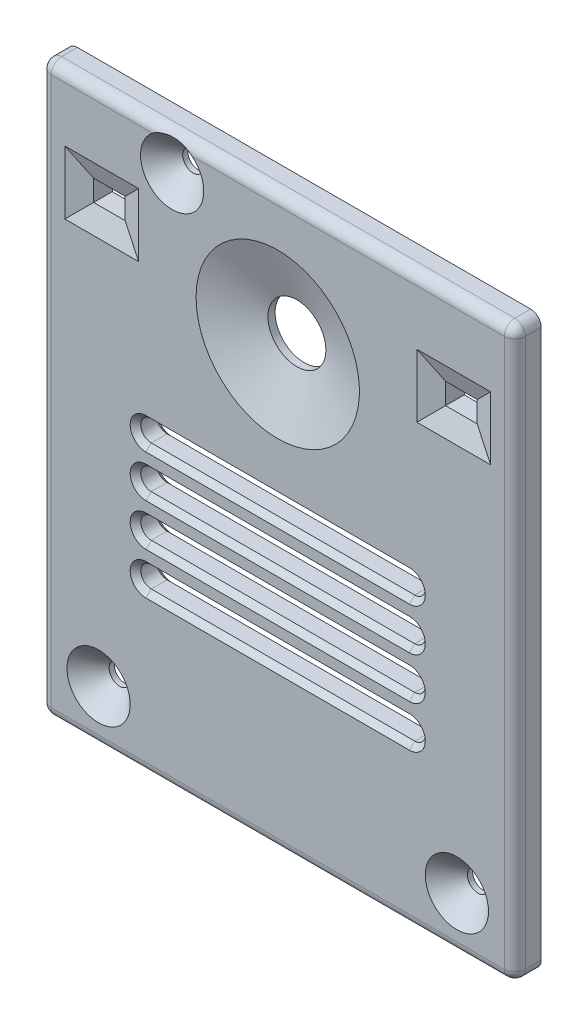
from build123d import *

# Parameters (mm, degrees)
SKETCH1_R           = 1
SKETCH1_R_2         = 1.0000000000000018
BOSS_EXTRUDE1_DEPTH = 2.5
SKETCH2_R           = 2.7499999999999996
CUT_EXTRUDE1_DEPTH  = 2.5
CHAMFER1_SIZE       = 5
CHAMFER1_SIZE2      = 1.819851171331016
CUT_EXTRUDE2_DEPTH  = 2.5
CHAMFER2_SIZE       = 0.5
CHAMFER3_SIZE       = 2
SKETCH4_W           = 2.9999999999999982
SKETCH4_H           = 2
CUT_EXTRUDE3_DEPTH  = 2.5
CHAMFER4_SIZE       = 2
CHAMFER4_SIZE2      = 0.7279404685324065
FILLET1_R           = 1


with BuildPart() as part:
    # Sketch1 → Boss-Extrude1 (new body)
    with BuildSketch(Plane.XY):
        with BuildLine():
            Line((21.499999999999993, -26.999999999999996), (-21.499999999999993, -26.999999999999996))
            ThreePointArc((-21.499999999999993, -26.999999999999996), (-22.207106781186546, -26.707106781186543), (-22.5, -25.99999999999999))
            Line((-22.5, -25.99999999999999), (-22.5, 25.99999999999999))
            ThreePointArc((-22.5, 25.99999999999999), (-22.207106781186546, 26.707106781186543), (-21.499999999999993, 26.999999999999996))
            Line((-21.499999999999993, 26.999999999999996), (21.499999999999993, 26.999999999999996))
            ThreePointArc((21.499999999999993, 26.999999999999996), (22.207106781186546, 26.707106781186543), (22.5, 25.99999999999999))
            Line((22.5, 25.99999999999999), (22.5, -25.99999999999999))
            ThreePointArc((22.5, -25.99999999999999), (22.207106781186546, -26.707106781186543), (21.499999999999993, -26.999999999999996))
        make_face()
        with Locations((-10.018444645439217, 23.665000000000006)):
            Circle(SKETCH1_R, mode=Mode.SUBTRACT)
        with Locations((-17, -22.000000000000007)):
            Circle(SKETCH1_R_2, mode=Mode.SUBTRACT)
        with Locations((17, -22.000000000000004)):
            Circle(SKETCH1_R_2, mode=Mode.SUBTRACT)
    extrude(amount=BOSS_EXTRUDE1_DEPTH)

    # Sketch2 → Cut-Extrude1 (cut)
    with BuildSketch(Plane.XY.offset(2.5)):
        with Locations((0, 14.599999999999996)):
            Circle(SKETCH2_R)
    extrude(amount=-CUT_EXTRUDE1_DEPTH, mode=Mode.SUBTRACT)

    # Chamfer1
    chamfer1_edges = [part.edges().sort_by_distance(p)[0] for p in [
        (-2.7499999999999996, 14.599999999999996, 2.5),
    ]]
    chamfer1_side = [part.faces().sort_by_distance(p)[0] for p in [
        (0.01313623413448006, -0.11811006320101064, 2.5),
    ]]
    chamfer(chamfer1_edges, length=CHAMFER1_SIZE, length2=CHAMFER1_SIZE2, reference=chamfer1_side[0])

    # Sketch3 → Cut-Extrude2 (cut)
    with BuildSketch(Plane.XY.offset(2.5)):
        with BuildLine():
            Line((-12.5, 2), (12.5, 2.0000000000000053))
            ThreePointArc((12.5, 2.0000000000000053), (13.5, 1.0000000000000036), (12.5, 4.34e-15))
            Line((12.5, 4.34e-15), (-12.5, 0))
            ThreePointArc((-12.5, 0), (-13.5, 1.0000000000000002), (-12.5, 2))
        make_face()
        with BuildLine():
            Line((-12.5, -2), (12.5, -2))
            ThreePointArc((12.5, -2), (13.5, -3), (12.5, -4))
            Line((12.5, -4), (-12.5, -4))
            ThreePointArc((-12.5, -4), (-13.5, -3), (-12.5, -2))
        make_face()
        with BuildLine():
            Line((-12.5, -6.000000000000001), (12.5, -6.000000000000001))
            ThreePointArc((12.5, -6.000000000000001), (13.5, -7), (12.5, -8))
            Line((12.5, -8), (-12.5, -8))
            ThreePointArc((-12.5, -8), (-13.5, -7), (-12.5, -6.000000000000001))
        make_face()
        with BuildLine():
            Line((-12.5, -9.999999999999998), (12.5, -9.999999999999998))
            ThreePointArc((12.5, -9.999999999999998), (13.5, -11), (12.5, -12))
            Line((12.5, -12), (-12.5, -12))
            ThreePointArc((-12.5, -12), (-13.500000000000002, -11), (-12.5, -9.999999999999998))
        make_face()
    extrude(amount=-CUT_EXTRUDE2_DEPTH, mode=Mode.SUBTRACT)

    # Chamfer2
    chamfer2_edges = [part.edges().sort_by_distance(p)[0] for p in [
        (-13.5, 0.9999999999999999, 0),
        (0, 2.0000000000000027, 0),
        (13.5, 1.0000000000000049, 0),
        (0, 2.17e-15, 0),
        (-13.5, 0.9999999999999999, 2.5),
        (0, 2.17e-15, 2.5),
        (13.5, 1.0000000000000049, 2.5),
        (0, 2.0000000000000027, 2.5),
        (-13.5, -3, 0),
        (0, -2, 0),
        (13.5, -3, 0),
        (0, -4, 0),
        (-13.5, -3, 2.5),
        (0, -4, 2.5),
        (13.5, -3, 2.5),
        (0, -2, 2.5),
        (-13.5, -7, 0),
        (0, -6.000000000000001, 0),
        (13.5, -7, 0),
        (0, -8, 0),
        (-13.5, -7, 2.5),
        (0, -8, 2.5),
        (13.5, -7, 2.5),
        (0, -6.000000000000001, 2.5),
        (-13.500000000000002, -11, 0),
        (0, -9.999999999999998, 0),
        (13.5, -11, 0),
        (0, -12, 0),
        (-13.500000000000002, -11, 2.5),
        (0, -12, 2.5),
        (13.5, -11, 2.5),
        (0, -9.999999999999998, 2.5),
    ]]
    chamfer(chamfer2_edges, length=CHAMFER2_SIZE)

    # Chamfer3
    chamfer3_edges = [part.edges().sort_by_distance(p)[0] for p in [
        (-11.018444645439217, 23.665000000000006, 2.5),
        (-18, -22.000000000000007, 2.5),
        (15.999999999999998, -22.000000000000004, 2.5),
    ]]
    chamfer(chamfer3_edges, length=CHAMFER3_SIZE)

    # Sketch4 → Cut-Extrude3 (cut)
    with BuildSketch(Plane.XY.offset(2.5)):
        with Locations((-16.7, 17.799999999999997)):
            Rectangle(SKETCH4_W, SKETCH4_H)
        with Locations((16.7, 17.799999999999997)):
            Rectangle(SKETCH4_W, SKETCH4_H)
    extrude(amount=-CUT_EXTRUDE3_DEPTH, mode=Mode.SUBTRACT)

    # Chamfer4
    chamfer4_edges = [part.edges().sort_by_distance(p)[0] for p in [
        (-15.200000000000001, 17.799999999999997, 2.5),
        (-16.7, 18.799999999999997, 2.5),
        (-18.2, 17.799999999999997, 2.5),
        (-16.7, 16.799999999999997, 2.5),
        (18.2, 17.799999999999997, 2.5),
        (16.7, 18.799999999999997, 2.5),
        (15.200000000000001, 17.799999999999997, 2.5),
        (16.7, 16.799999999999997, 2.5),
    ]]
    chamfer4_side = [part.faces().sort_by_distance(p)[0] for p in [
        (0, -26.297077529168398, 2.5),
    ]]
    chamfer(chamfer4_edges, length=CHAMFER4_SIZE, length2=CHAMFER4_SIZE2, reference=chamfer4_side[0])

    # Fillet1
    # the kernel refuses this fillet: 1 mm, written as the material it takes off along each edge
    with BuildSketch(Plane(origin=(21.499999999999996, -25.999999999999993, 2.5), x_dir=(1, 3.55e-15, 0), z_dir=(-3.55e-15, 1, 0))) as fillet1_piece_1:
        with BuildLine():
            CenterArc((1.0000000000000036 - FILLET1_R, FILLET1_R), FILLET1_R, 270, 90)
            Line((1.0000000000000036, FILLET1_R), (1.0000000000000036, 0))
            Line((1.0000000000000036, 0), (1.0000000000000036 - FILLET1_R, 0))
        make_face()
    revolve(axis=Axis((21.499999999999996, -25.999999999999993, 2.5), (0, 0, -1)), revolution_arc=90.00000000000041, mode=Mode.SUBTRACT)
    with BuildSketch(Plane(origin=(22.5, 25.99999999999999, 2.5), x_dir=(-1, 0, 0), z_dir=(0, -1, 0)), Plane(origin=(-22.5, -25.99999999999999, 2.5), x_dir=(1, 0, 0), z_dir=(0, 1, 0))) as fillet1_piece_2:
        with BuildLine():
            CenterArc((FILLET1_R, FILLET1_R), FILLET1_R, 180, 90)
            Line((0, FILLET1_R), (0, 0))
            Line((0, 0), (FILLET1_R, 0))
        make_face()
    extrude(amount=51.99999999999998, mode=Mode.SUBTRACT)
    with BuildSketch(Plane(origin=(21.499999999999996, 25.999999999999993, 2.5), x_dir=(-3.55e-15, 1, 0), z_dir=(-1, -3.55e-15, 0))) as fillet1_piece_3:
        with BuildLine():
            CenterArc((1.0000000000000036 - FILLET1_R, FILLET1_R), FILLET1_R, 270, 90)
            Line((1.0000000000000036, FILLET1_R), (1.0000000000000036, 0))
            Line((1.0000000000000036, 0), (1.0000000000000036 - FILLET1_R, 0))
        make_face()
    revolve(axis=Axis((21.499999999999996, 25.999999999999993, 2.5), (0, 0, -1)), revolution_arc=90.00000000000041, mode=Mode.SUBTRACT)
    with BuildSketch(Plane(origin=(-21.499999999999993, 26.999999999999996, 2.5), x_dir=(0, -1, 0), z_dir=(1, 0, 0)), Plane(origin=(21.499999999999993, -26.999999999999996, 2.5), x_dir=(0, 1, 0), z_dir=(-1, 0, 0))) as fillet1_piece_4:
        with BuildLine():
            CenterArc((FILLET1_R, FILLET1_R), FILLET1_R, 180, 90)
            Line((0, FILLET1_R), (0, 0))
            Line((0, 0), (FILLET1_R, 0))
        make_face()
    extrude(amount=42.999999999999986, mode=Mode.SUBTRACT)
    with BuildSketch(Plane(origin=(-21.499999999999996, 25.999999999999993, 2.5), x_dir=(-1, -3.55e-15, 0), z_dir=(3.55e-15, -1, 0))) as fillet1_piece_5:
        with BuildLine():
            CenterArc((1.0000000000000036 - FILLET1_R, FILLET1_R), FILLET1_R, 270, 90)
            Line((1.0000000000000036, FILLET1_R), (1.0000000000000036, 0))
            Line((1.0000000000000036, 0), (1.0000000000000036 - FILLET1_R, 0))
        make_face()
    revolve(axis=Axis((-21.499999999999996, 25.999999999999993, 2.5), (0, 0, -1)), revolution_arc=90.00000000000041, mode=Mode.SUBTRACT)
    with BuildSketch(Plane(origin=(-21.499999999999996, -25.999999999999993, 2.5), x_dir=(3.55e-15, -1, 0), z_dir=(1, 3.55e-15, 0))) as fillet1_piece_6:
        with BuildLine():
            CenterArc((1.0000000000000036 - FILLET1_R, FILLET1_R), FILLET1_R, 270, 90)
            Line((1.0000000000000036, FILLET1_R), (1.0000000000000036, 0))
            Line((1.0000000000000036, 0), (1.0000000000000036 - FILLET1_R, 0))
        make_face()
    revolve(axis=Axis((-21.499999999999996, -25.999999999999993, 2.5), (0, 0, -1)), revolution_arc=90.00000000000041, mode=Mode.SUBTRACT)


solid = part.part
